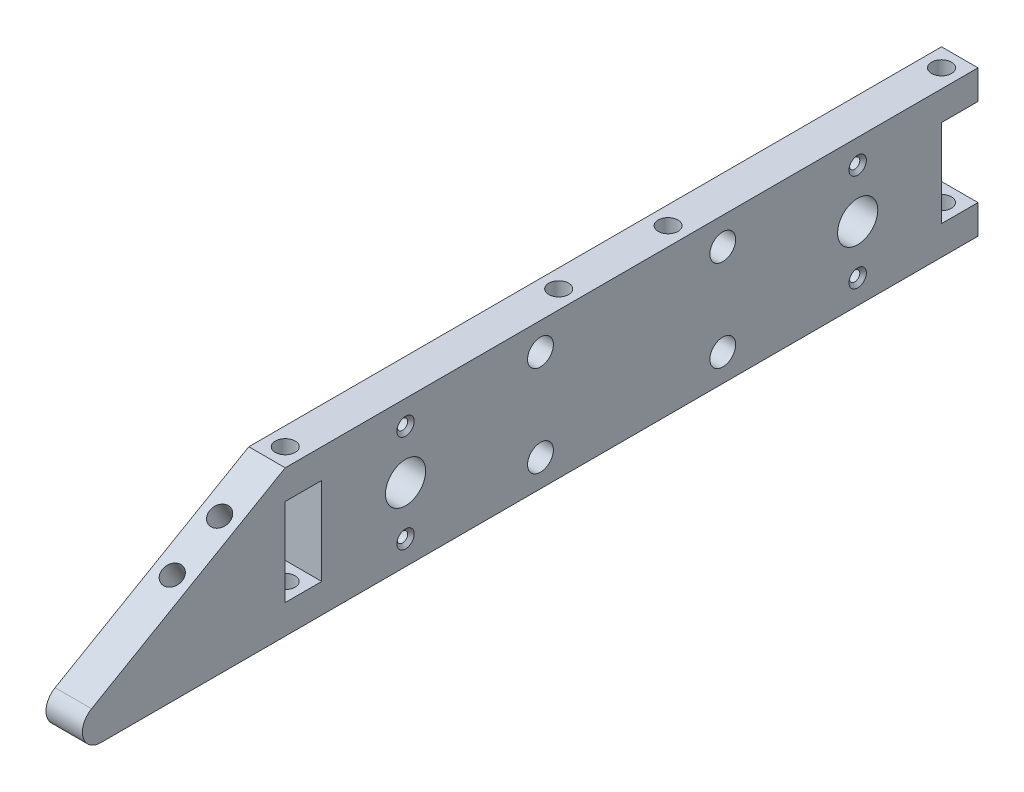
from build123d import *

# Parameters (mm, degrees)
SKETCH1_W                          = 120.65
SKETCH1_H                          = 25.4
BOSS_EXTRUDE1_DEPTH                = 3.175
CUT_EXTRUDE1_REACH                 = 107.281
SKETCH4_R                          = 3.5
F_8_CLEARANCE_HOLE1_D              = 4.4958
FILLET3_R                          = 3.175
CUT_EXTRUDE3_REACH                 = 98.693
SKETCH12_W                         = 6.35
SKETCH12_H                         = 15.24
TAP_DRILL_FOR_8_32_TAP1_D          = 3.4544
TAP_DRILL_FOR_8_32_TAP1_DEPTH      = 12.7
TAP_DRILL_FOR_8_32_TAP1_TIP        = 1.037806461
TAP_DRILL_FOR_8_32_TAP2_AT_2_COUNT = 2
TAP_DRILL_FOR_8_32_TAP2_AT_2_PITCH = 47.625
TAP_DRILL_FOR_8_32_TAP2_AT_3_COUNT = 2
TAP_DRILL_FOR_8_32_TAP2_AT_3_PITCH = 66.675
TAP_DRILL_FOR_8_32_TAP2_AT_4_COUNT = 2
TAP_DRILL_FOR_8_32_TAP2_AT_4_PITCH = 114.3


# Read off the part's stored shape, not the designer's step: AdvancedHole1
with BuildPart() as part:
    # Sketch1 → Boss-Extrude1 (new, symmetric)
    with BuildSketch(Plane(origin=(0, 0, 0), x_dir=(0, 0, -1), z_dir=(1, 0, 0))):
        Rectangle(SKETCH1_W, SKETCH1_H)
        Polygon((-60.325, 12.7), (-104.319090512, -12.7), (-60.325, -12.7), align=None)
    extrude(amount=BOSS_EXTRUDE1_DEPTH, both=True)

    # Sketch4 → Cut-Extrude1 (cut, up to next)
    with BuildSketch(Plane(origin=(3.175, 0, 0), x_dir=(0, 0, -1), z_dir=(1, 0, 0)), mode=Mode.PRIVATE) as cut_extrude1_sk1:
        with Locations((-39.37, 0)):
            Circle(SKETCH4_R)
    cut_extrude1_tool1 = extrude(cut_extrude1_sk1.sketch, amount=-CUT_EXTRUDE1_REACH, mode=Mode.PRIVATE) & part.part
    # Sketch4 → Cut-Extrude1 (cut, up to next)
    with BuildSketch(Plane(origin=(3.175, 0, 0), x_dir=(0, 0, -1), z_dir=(1, 0, 0)), mode=Mode.PRIVATE) as cut_extrude1_sk2:
        with Locations((39.37, 0)):
            Circle(SKETCH4_R)
    cut_extrude1_tool2 = extrude(cut_extrude1_sk2.sketch, amount=-CUT_EXTRUDE1_REACH, mode=Mode.PRIVATE) & part.part
    add(cut_extrude1_tool1.solids().sort_by_distance((3.175, 0, 39.37))[0], mode=Mode.SUBTRACT)
    add(cut_extrude1_tool2.solids().sort_by_distance((3.175, 0, -39.37))[0], mode=Mode.SUBTRACT)

    # AdvancedHole1 outline → AdvancedHole1 (revolve, cut)
    with BuildSketch(Plane(origin=(0, -8.5, -39.37), x_dir=(0, 1, 0), z_dir=(0, 0, -1))):
        Polygon((0.889, 2.6528283), (1.5113, 3.175), (0, 3.175), (0, -3.175), (1.7, -3.175), (1.7, 2.6528283), align=None)
    revolve(axis=Axis((0, -8.5, -39.37), (1, 0, 0)), mode=Mode.SUBTRACT)

    # AdvancedHole1 2 outline → AdvancedHole1 2 (revolve, cut)
    with BuildSketch(Plane(origin=(0, 8.5, -39.37), x_dir=(0, 1, 0), z_dir=(0, 0, -1))):
        Polygon((0.889, 2.6528283), (1.5113, 3.175), (0, 3.175), (0, -3.175), (1.7, -3.175), (1.7, 2.6528283), align=None)
    revolve(axis=Axis((0, 8.5, -39.37), (1, 0, 0)), mode=Mode.SUBTRACT)

    # AdvancedHole1 3 outline → AdvancedHole1 3 (revolve, cut)
    with BuildSketch(Plane(origin=(0, -8.5, 39.37), x_dir=(0, 1, 0), z_dir=(0, 0, -1))):
        Polygon((0.889, 2.6528283), (1.5113, 3.175), (0, 3.175), (0, -3.175), (1.7, -3.175), (1.7, 2.6528283), align=None)
    revolve(axis=Axis((0, -8.5, 39.37), (1, 0, 0)), mode=Mode.SUBTRACT)

    # AdvancedHole1 4 outline → AdvancedHole1 4 (revolve, cut)
    with BuildSketch(Plane(origin=(0, 8.5, 39.37), x_dir=(0, 1, 0), z_dir=(0, 0, -1))):
        Polygon((0.889, 2.6528283), (1.5113, 3.175), (0, 3.175), (0, -3.175), (1.7, -3.175), (1.7, 2.6528283), align=None)
    revolve(axis=Axis((0, 8.5, 39.37), (1, 0, 0)), mode=Mode.SUBTRACT)

    # #8 Clearance Hole1 (through all)
    with Locations(Plane(origin=(3.175, 0, 0), x_dir=(0, 0, -1), z_dir=(1, 0, 0))):
        with Locations((-15.875, 7.9375), (-15.875, -7.9375), (15.875, -7.9375), (15.875, 7.9375)):
            Hole(F_8_CLEARANCE_HOLE1_D / 2)

    # Fillet3
    fillet3_edges = [part.edges().sort_by_distance(p)[0] for p in [
        (0, -12.7, 104.319090512),
    ]]
    fillet(fillet3_edges, radius=FILLET3_R)

    # Sketch12 → Cut-Extrude3 (cut, up to next)
    with BuildSketch(Plane(origin=(3.175, 0, 0), x_dir=(0, 0, -1), z_dir=(1, 0, 0)), mode=Mode.PRIVATE) as cut_extrude3_sk1:
        with Locations((-57.15, 0)):
            Rectangle(SKETCH12_W, SKETCH12_H)
    cut_extrude3_tool1 = extrude(cut_extrude3_sk1.sketch, amount=-CUT_EXTRUDE3_REACH, mode=Mode.PRIVATE) & part.part
    # Sketch12 → Cut-Extrude3 (cut, up to next)
    with BuildSketch(Plane(origin=(3.175, 0, 0), x_dir=(0, 0, -1), z_dir=(1, 0, 0)), mode=Mode.PRIVATE) as cut_extrude3_sk2:
        with Locations((57.15, 0)):
            Rectangle(SKETCH12_W, SKETCH12_H)
    cut_extrude3_tool2 = extrude(cut_extrude3_sk2.sketch, amount=-CUT_EXTRUDE3_REACH, mode=Mode.PRIVATE) & part.part
    add(cut_extrude3_tool1.solids().sort_by_distance((3.175, 0, 57.15))[0], mode=Mode.SUBTRACT)
    add(cut_extrude3_tool2.solids().sort_by_distance((3.175, 0, -57.15))[0], mode=Mode.SUBTRACT)

    # Tap Drill for #8-32 Tap1
    with Locations(Plane(origin=(0, 35.646491242, 20.580511314), x_dir=(1, 0, 0), z_dir=(0, 0.8660254037844417, 0.4999999999999949))):
        with Locations((0, -64.942982483), (0, -55.417982483)):
            Hole(TAP_DRILL_FOR_8_32_TAP1_D / 2, depth=TAP_DRILL_FOR_8_32_TAP1_DEPTH)
            with Locations((0, 0, -(TAP_DRILL_FOR_8_32_TAP1_DEPTH + TAP_DRILL_FOR_8_32_TAP1_TIP / 2))):  # 118° drill point
                Cone(0, TAP_DRILL_FOR_8_32_TAP1_D / 2, TAP_DRILL_FOR_8_32_TAP1_TIP, mode=Mode.SUBTRACT)

    # Sketch20 → Tap Drill for #8-32 Tap2 (revolve, cut)
    with BuildSketch(Plane(origin=(0, 12.7, 57.15), x_dir=(0, 0, 1), z_dir=(1, 0, 0))):
        Polygon((0, 0), (0, 13.737806461), (1.7272, 12.7), (1.7272, 0), align=None)
    tap_drill_for_8_32_tap2 = revolve(axis=Axis((0, 19.05, 57.15), (0, -1, 0)), mode=Mode.SUBTRACT)

    # Tap Drill for #8-32 Tap2 at 2: Tap Drill for #8-32 Tap2 ×2
    with Locations(*[(0, 0, -i * TAP_DRILL_FOR_8_32_TAP2_AT_2_PITCH) for i in range(1, TAP_DRILL_FOR_8_32_TAP2_AT_2_COUNT)]):
        add(tap_drill_for_8_32_tap2, mode=Mode.SUBTRACT)

    # Tap Drill for #8-32 Tap2 at 3: Tap Drill for #8-32 Tap2 ×2
    with Locations(*[(0, 0, -i * TAP_DRILL_FOR_8_32_TAP2_AT_3_PITCH) for i in range(1, TAP_DRILL_FOR_8_32_TAP2_AT_3_COUNT)]):
        add(tap_drill_for_8_32_tap2, mode=Mode.SUBTRACT)

    # Tap Drill for #8-32 Tap2 at 4: Tap Drill for #8-32 Tap2 ×2
    with Locations(*[(0, 0, -i * TAP_DRILL_FOR_8_32_TAP2_AT_4_PITCH) for i in range(1, TAP_DRILL_FOR_8_32_TAP2_AT_4_COUNT)]):
        add(tap_drill_for_8_32_tap2, mode=Mode.SUBTRACT)

    # Mirror1: Tap Drill for #8-32 Tap2 across plane
    add(tap_drill_for_8_32_tap2.mirror(Plane.ZX), mode=Mode.SUBTRACT)

    # Mirror1 copy 1 sketch → Mirror1 copy 1 (revolve, cut)
    with BuildSketch(Plane(origin=(0, -12.7, 9.525), x_dir=(0, 0, 1), z_dir=(1, 0, 0))):
        Polygon((0, 0), (0, -13.737806461), (1.7272, -12.7), (1.7272, 0), align=None)
    revolve(axis=Axis((0, -19.05, 9.525), (0, -1, 0)), mode=Mode.SUBTRACT)

    # Mirror1 copy 2 sketch → Mirror1 copy 2 (revolve, cut)
    with BuildSketch(Plane(origin=(0, -12.7, -9.525), x_dir=(0, 0, 1), z_dir=(1, 0, 0))):
        Polygon((0, 0), (0, -13.737806461), (1.7272, -12.7), (1.7272, 0), align=None)
    revolve(axis=Axis((0, -19.05, -9.525), (0, -1, 0)), mode=Mode.SUBTRACT)

    # Mirror1 copy 3 sketch → Mirror1 copy 3 (revolve, cut)
    with BuildSketch(Plane(origin=(0, -12.7, -57.15), x_dir=(0, 0, 1), z_dir=(1, 0, 0))):
        Polygon((0, 0), (0, -13.737806461), (1.7272, -12.7), (1.7272, 0), align=None)
    revolve(axis=Axis((0, -19.05, -57.15), (0, -1, 0)), mode=Mode.SUBTRACT)


solid = part.part
